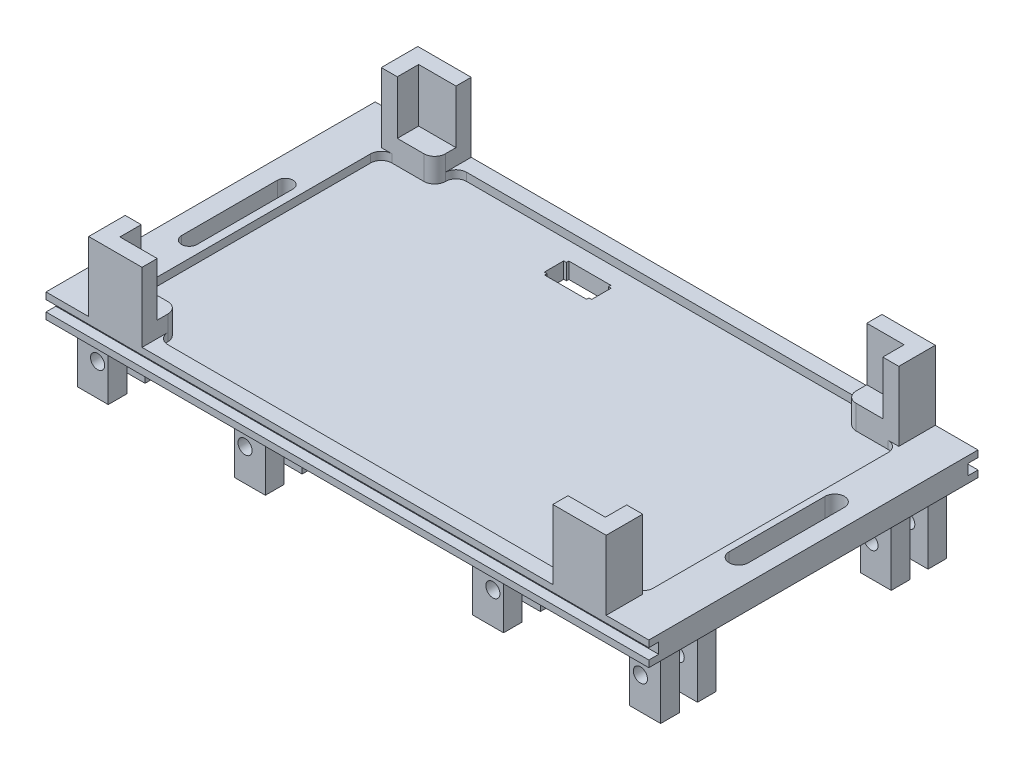
from build123d import *

# Parameters (mm, degrees)
SKETCH_1_W                                 = 180
SKETCH_1_H                                 = 90
EXTRUDE_1_DEPTH                            = 4.5
SKETCH_2_W                                 = 10
SKETCH_2_H                                 = 7
EXTRUDE_2_DEPTH                            = 3
EXTRUDE_3_DEPTH                            = 10
SKETCH_9_W                                 = 180
SKETCH_9_H                                 = 90
SKETCH_9_W_2                               = 97
SKETCH_9_H_2                               = 62
CUT_EXTRUDE_3_DEPTH                        = 13
SKETCH_10_W                                = 8
SKETCH_10_H                                = 62
EXTRUDE_5_DEPTH                            = 4.5
SKETCH_11_W                                = 5.8
SKETCH_11_H                                = 3.5
EXTRUDE_6_DEPTH                            = 12
SKETCH_12_R                                = 1.325
CUT_EXTRUDE_4_DEPTH                        = 83.706757767
MIRROR_4_AT_THE_SECOND_PLANE_COPY_1_SKET_W = 5.8
MIRROR_4_AT_THE_SECOND_PLANE_COPY_1_SKET_H = 3.5
MIRROR_4_AT_THE_SECOND_PLANE_COPY_1_DEPTH  = 12
MIRROR_4_AT_THE_SECOND_PLANE_COPY_2_SKET_R = 1.325
MIRROR_4_AT_THE_SECOND_PLANE_COPY_2_DEPTH  = 83.706757767
CUT_EXTRUDE_START                          = -8
CUT_EXTRUDE_5_DEPTH                        = 8
SKETCH_15_W                                = 2
SKETCH_15_H                                = 2
CUT_EXTRUDE_6_DEPTH                        = 119.474680839
SKETCH_16_W                                = 113
SKETCH_16_H                                = 0.15
CUT_EXTRUDE_7_DEPTH                        = 67.779487869
CUT_EXTRUDE_8_DEPTH                        = 10
CUT_EXTRUDE_9_DEPTH                        = 10
CUT_EXTRUDE_10_DEPTH                       = 1.5
FILLET_1_R                                 = 2


with BuildPart() as part:
    # 草图1 → 凸台-拉伸1 (new body)
    with BuildSketch(Plane(origin=(0, 0, 0), x_dir=(1, 0, 0), z_dir=(0, 1, 0))):
        Rectangle(SKETCH_1_W, SKETCH_1_H)
    extrude(amount=EXTRUDE_1_DEPTH)

    # 草图2 → 凸台-拉伸2 (add)
    with BuildSketch(Plane(origin=(0, 4.5, 0), x_dir=(1, 0, 0), z_dir=(0, 1, 0))):
        with Locations((43.5, 27.5)):
            Rectangle(SKETCH_2_W, SKETCH_2_H)
        with Locations((-43.5, 27.5)):
            Rectangle(SKETCH_2_W, SKETCH_2_H)
        with Locations((-43.5, -27.5)):
            Rectangle(SKETCH_2_W, SKETCH_2_H)
        with Locations((43.5, -27.5)):
            Rectangle(SKETCH_2_W, SKETCH_2_H)
    extrude(amount=EXTRUDE_2_DEPTH)

    # 草图3 → 凸台-拉伸3 (add)
    with BuildSketch(Plane(origin=(0, 7.5, 0), x_dir=(1, 0, 0), z_dir=(0, 1, 0))):
        Polygon((-48.5, 31), (-48.5, 24), (-45.5, 24), (-45.5, 28), (-38.5, 28), (-38.5, 31), align=None)
        Polygon((38.5, 28), (38.5, 31), (48.5, 31), (48.5, 24), (45.5, 24), (45.5, 28), align=None)
        Polygon((38.5, -31), (48.5, -31), (48.5, -24), (45.5, -24), (45.5, -28), (38.5, -28), align=None)
        Polygon((-38.5, -28), (-38.5, -31), (-48.5, -31), (-48.5, -24), (-45.5, -24), (-45.5, -28), align=None)
    extrude(amount=EXTRUDE_3_DEPTH)

    # 草图9 → 切除-拉伸3 (cut)
    with BuildSketch(Plane(origin=(0, 4.5, 0), x_dir=(1, 0, 0), z_dir=(0, 1, 0))):
        Rectangle(SKETCH_9_W, SKETCH_9_H)
        Rectangle(SKETCH_9_W_2, SKETCH_9_H_2, mode=Mode.SUBTRACT)
    extrude(amount=-CUT_EXTRUDE_3_DEPTH, mode=Mode.SUBTRACT)

    # 草图10 → 凸台-拉伸5 (add)
    # profile 1 of 2: a face of its own
    with BuildSketch(Plane(origin=(0, 4.5, 0), x_dir=(1, 0, 0), z_dir=(0, 1, 0))):
        with Locations((-52.5, 0)):
            Rectangle(SKETCH_10_W, SKETCH_10_H)
        with BuildLine():
            Line((-52.95, 9), (-52.95, -9))
            ThreePointArc((-52.95, -9), (-51.5, -10.45), (-50.05, -9))
            Line((-50.05, -9), (-50.05, 9))
            ThreePointArc((-50.05, 9), (-51.5, 10.45), (-52.95, 9))
        make_face(mode=Mode.SUBTRACT)
    # profile 2 of 2: a face of its own
    with BuildSketch(Plane(origin=(0, 4.5, 0), x_dir=(1, 0, 0), z_dir=(0, 1, 0))):
        with Locations((52.5, 0)):
            Rectangle(SKETCH_10_W, SKETCH_10_H)
        with BuildLine():
            Line((52.95, 9), (52.95, -9))
            ThreePointArc((52.95, -9), (51.5, -10.45), (50.05, -9))
            Line((50.05, -9), (50.05, 9))
            ThreePointArc((50.05, 9), (51.5, 10.45), (52.95, 9))
        make_face(mode=Mode.SUBTRACT)
    extrude(amount=-EXTRUDE_5_DEPTH)

    # 草图11 → 凸台-拉伸6 (add)
    with BuildSketch(Plane.XZ):
        with Locations((51.775, 18.159236117)):
            Rectangle(SKETCH_11_W, SKETCH_11_H)
        with Locations((51.775, 25.059236117)):
            Rectangle(SKETCH_11_W, SKETCH_11_H)
        with Locations((22.325, 25.059236117)):
            Rectangle(SKETCH_11_W, SKETCH_11_H)
        with Locations((22.325, 18.159236117)):
            Rectangle(SKETCH_11_W, SKETCH_11_H)
    extrude_6 = extrude(amount=EXTRUDE_6_DEPTH)

    # 草图12 → 切除-拉伸4 (cut, through all)
    with BuildSketch(Plane.XY.offset(26.809236117)):
        with Locations((50.875, -6)):
            Circle(SKETCH_12_R)
        with Locations((23.225, -6)):
            Circle(SKETCH_12_R)
    cut_extrude_4 = extrude(amount=-CUT_EXTRUDE_4_DEPTH, mode=Mode.SUBTRACT)

    # 镜向4: 凸台-拉伸6, 切除-拉伸4 across plane
    add(extrude_6.mirror(Plane(origin=(0, 0, 0), x_dir=(0, 0, 1), z_dir=(1, 0, 0))))
    add(cut_extrude_4.mirror(Plane(origin=(0, 0, 0), x_dir=(0, 0, 1), z_dir=(1, 0, 0))), mode=Mode.SUBTRACT)

    # 镜向4 at the second plane: 凸台-拉伸6, 切除-拉伸4 across plane
    add(extrude_6.mirror(Plane.XY))
    add(cut_extrude_4.mirror(Plane.XY), mode=Mode.SUBTRACT)

    # 镜向4 at the second plane copy 1 sket → 镜向4 at the second plane copy 1 (add)
    with BuildSketch(Plane(origin=(0, 0, 0), x_dir=(-1, 0, 0), z_dir=(0, -1, 0))):
        with Locations((51.775, 18.159236117)):
            Rectangle(MIRROR_4_AT_THE_SECOND_PLANE_COPY_1_SKET_W, MIRROR_4_AT_THE_SECOND_PLANE_COPY_1_SKET_H)
        with Locations((51.775, 25.059236117)):
            Rectangle(MIRROR_4_AT_THE_SECOND_PLANE_COPY_1_SKET_W, MIRROR_4_AT_THE_SECOND_PLANE_COPY_1_SKET_H)
        with Locations((22.325, 25.059236117)):
            Rectangle(MIRROR_4_AT_THE_SECOND_PLANE_COPY_1_SKET_W, MIRROR_4_AT_THE_SECOND_PLANE_COPY_1_SKET_H)
        with Locations((22.325, 18.159236117)):
            Rectangle(MIRROR_4_AT_THE_SECOND_PLANE_COPY_1_SKET_W, MIRROR_4_AT_THE_SECOND_PLANE_COPY_1_SKET_H)
    extrude(amount=MIRROR_4_AT_THE_SECOND_PLANE_COPY_1_DEPTH)

    # 镜向4 at the second plane copy 2 sket → 镜向4 at the second plane copy 2 (cut, through all)
    with BuildSketch(Plane(origin=(0, 0, -26.809236117), x_dir=(-1, 0, 0), z_dir=(0, 0, -1))):
        with Locations((50.875, -6)):
            Circle(MIRROR_4_AT_THE_SECOND_PLANE_COPY_2_SKET_R)
        with Locations((23.225, -6)):
            Circle(MIRROR_4_AT_THE_SECOND_PLANE_COPY_2_SKET_R)
    extrude(amount=-MIRROR_4_AT_THE_SECOND_PLANE_COPY_2_DEPTH, mode=Mode.SUBTRACT)

    # 草图13 → 切除-拉伸5 (cut)
    with BuildSketch(Plane.XZ.offset(CUT_EXTRUDE_START)):
        with BuildLine():
            Line((53.3, 9), (53.3, -9))
            ThreePointArc((53.3, -9), (51.5, -10.8), (49.7, -9))
            Line((49.7, -9), (49.7, 9))
            ThreePointArc((49.7, 9), (51.5, 10.8), (53.3, 9))
        make_face()
        with BuildLine():
            Line((52.95, 9), (52.95, -9))
            ThreePointArc((52.95, -9), (51.5, -10.45), (50.05, -9))
            Line((50.05, -9), (50.05, 9))
            ThreePointArc((50.05, 9), (51.5, 10.45), (52.95, 9))
        make_face(mode=Mode.SUBTRACT)
    extrude(amount=CUT_EXTRUDE_5_DEPTH, mode=Mode.SUBTRACT)

    # 草图15 → 切除-拉伸6 (cut, through all)
    with BuildSketch(Plane(origin=(56.5, 0, 0), x_dir=(0, 0, -1), z_dir=(1, 0, 0))):
        with Locations((-30, 2.25)):
            Rectangle(SKETCH_15_W, SKETCH_15_H)
        with Locations((30, 2.25)):
            Rectangle(SKETCH_15_W, SKETCH_15_H)
    extrude(amount=-CUT_EXTRUDE_6_DEPTH, mode=Mode.SUBTRACT)

    # 草图16 → 切除-拉伸7 (cut, through all)
    with BuildSketch(Plane.XZ):
        with Locations((0, 30.925)):
            Rectangle(SKETCH_16_W, SKETCH_16_H)
        with Locations((0, -30.925)):
            Rectangle(SKETCH_16_W, SKETCH_16_H)
    extrude(amount=-CUT_EXTRUDE_7_DEPTH, mode=Mode.SUBTRACT)

    # 草图17 → 切除-拉伸8 (cut)
    with BuildSketch(Plane.XZ):
        Polygon((-6.297279033, -24.517889678), (-6.297279033, -24.062489679), (-5.791279035, -24.062489679), (-5.791279035, -20.722889692), (-6.297279033, -20.722889692), (-6.297279033, -20.267489693), (-13.861979005, -20.267489693), (-13.861979005, -20.722889692), (-14.367979003, -20.722889692), (-14.367979003, -24.062489679), (-13.861979005, -24.062489679), (-13.861979005, -24.517889678), align=None)
    extrude(amount=-CUT_EXTRUDE_8_DEPTH, mode=Mode.SUBTRACT)

    # 草图18 → 切除-拉伸9 (cut)
    with BuildSketch(Plane.XZ):
        Polygon((-6.147279033, -20.572889692), (-5.641279035, -20.572889692), (-5.641279035, -24.212489679), (-6.147279033, -24.212489679), (-6.147279033, -24.667889678), (-14.011979005, -24.667889678), (-14.011979005, -24.212489679), (-14.517979003, -24.212489679), (-14.517979003, -20.572889692), (-14.011979005, -20.572889692), (-14.011979005, -20.117489693), (-6.147279033, -20.117489693), align=None)
        Polygon((-14.367979003, -20.722889692), (-14.367979003, -24.062489679), (-13.861979005, -24.062489679), (-13.861979005, -24.517889678), (-6.297279033, -24.517889678), (-6.297279033, -24.062489679), (-5.791279035, -24.062489679), (-5.791279035, -20.722889692), (-6.297279033, -20.722889692), (-6.297279033, -20.267489693), (-13.861979005, -20.267489693), (-13.861979005, -20.722889692), align=None, mode=Mode.SUBTRACT)
    extrude(amount=-CUT_EXTRUDE_9_DEPTH, mode=Mode.SUBTRACT)

    # 草图19 → 切除-拉伸10 (cut)
    with BuildSketch(Plane(origin=(0, 4.5, 0), x_dir=(1, 0, 0), z_dir=(0, 1, 0))):
        Polygon((48.5, 24), (48.5, -24), (38.5, -24), (38.5, -28), (-38.5, -28), (-38.5, -24), (-48.5, -24), (-48.5, 24), (-38.5, 24), (-38.5, 28), (38.5, 28), (38.5, 24), align=None)
    extrude(amount=-CUT_EXTRUDE_10_DEPTH, mode=Mode.SUBTRACT)

    # 圆角1
    fillet_1_edges = [part.edges().sort_by_distance(p)[0] for p in [
        (48.5, 3.75, -24),
        (48.5, 3.75, 24),
        (38.5, 5.25, 24),
        (38.5, 3.75, 28),
        (-38.5, 5.25, 24),
        (-48.5, 3.75, -24),
        (-38.5, 5.25, -24),
        (-38.5, 3.75, -28),
        (38.5, 3.75, -28),
        (38.5, 5.25, -24),
        (-38.5, 3.75, 28),
        (-48.5, 3.75, 24),
    ]]
    fillet(fillet_1_edges, radius=FILLET_1_R - 0.0001)  # a hair under: the kernel refuses the full size


solid = part.part
